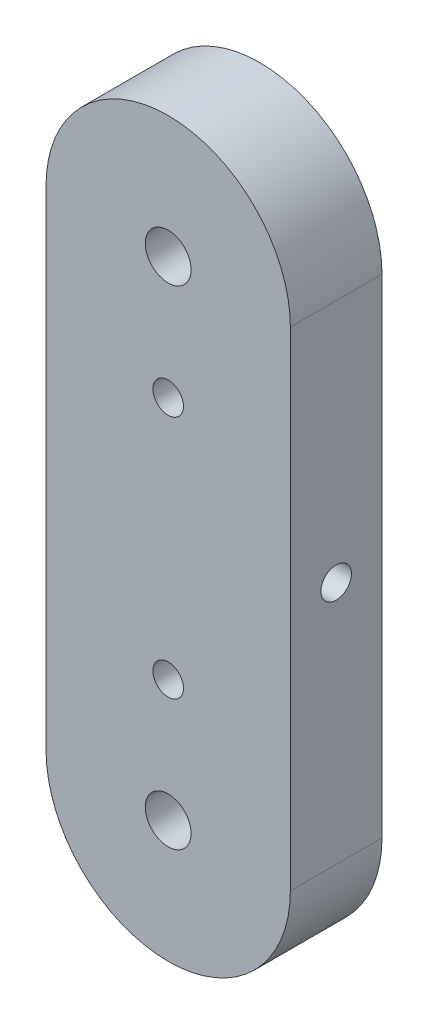
from build123d import *

# Parameters (mm, degrees)
BOSS_EXTRUDE1_DEPTH     = 38.1
SKETCH2_R               = 6.35
CUT_EXTRUDE1_DEPTH      = 277.034883433
ADVANCEDHOLE3_OUTLINE_R = 9.525
ADVANCEDHOLE3_DEPTH     = 38.1
SKETCH21_R              = 6.35
CUT_EXTRUDE2_DEPTH      = 35.56


# Read off the part's stored shape, not the designer's step: AdvancedHole3
with BuildPart() as part:
    # Sketch1 → Boss-Extrude1 (new body)
    with BuildSketch(Plane.XY):
        with BuildLine():
            Line((0, 0), (0, 203.013094366))
            ThreePointArc((0, 203.013094366), (50.8, 253.813094366), (101.6, 203.013094366))
            Line((101.6, 203.013094366), (101.6, 0))
            ThreePointArc((101.6, 0), (50.8, -50.8), (0, 0))
        make_face()
    extrude(amount=BOSS_EXTRUDE1_DEPTH)

    # Sketch2 → Cut-Extrude1 (cut, through all)
    with BuildSketch(Plane(origin=(101.6, 0, 0), x_dir=(0, 0, -1), z_dir=(1, 0, 0))):
        with Locations(Location((-19.05, 101.506547183, 0), (0, 0, 90))):
            Circle(SKETCH2_R)
    extrude(amount=-CUT_EXTRUDE1_DEPTH, mode=Mode.SUBTRACT)

    # AdvancedHole3 outline → AdvancedHole3 (cut)
    with BuildSketch(Plane.XY):
        with Locations((50.8, 203.013094366)):
            Circle(ADVANCEDHOLE3_OUTLINE_R)
        with Locations((50.8, 0)):
            Circle(ADVANCEDHOLE3_OUTLINE_R)
    extrude(amount=ADVANCEDHOLE3_DEPTH, mode=Mode.SUBTRACT)

    # Sketch21 → Cut-Extrude2 (cut)
    with BuildSketch(Plane.XY.offset(38.1)):
        with Locations((50.8, 50.706547183)):
            Circle(SKETCH21_R)
        with Locations((50.8, 152.213094366)):
            Circle(SKETCH21_R)
    extrude(amount=-CUT_EXTRUDE2_DEPTH, mode=Mode.SUBTRACT)


solid = part.part
